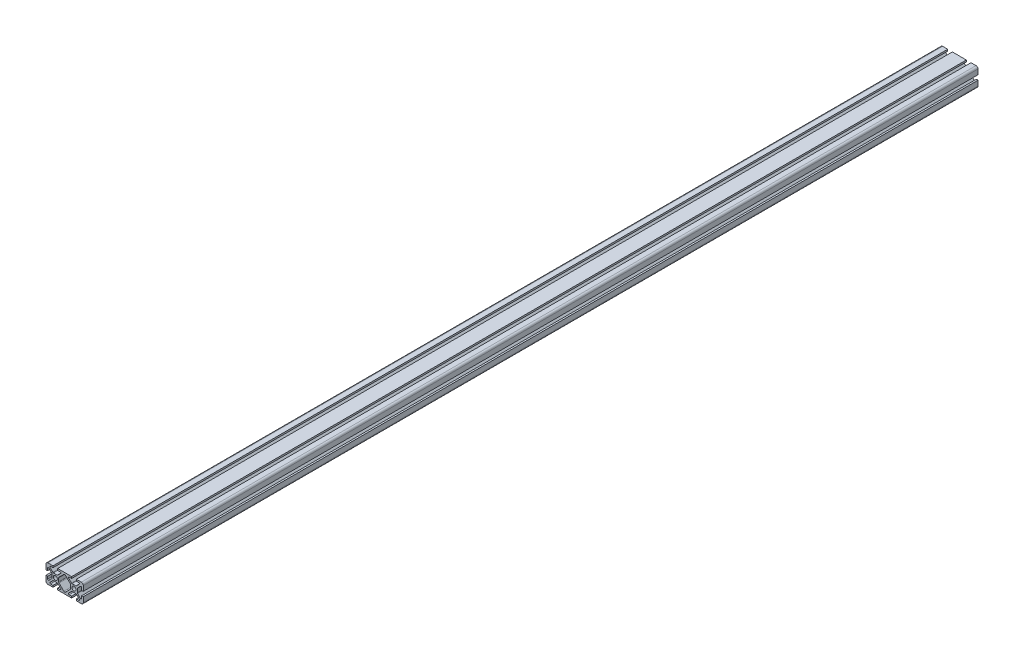
from build123d import *

# Parameters (mm, degrees)
BOSS_EXTRUDE1_DEPTH = 480
BOSS_EXTRUDE2_DEPTH = 480
FILLET1_R           = 0.75
FILLET2_R           = 1.25


with BuildPart() as part:
    # Sketch3 → Boss-Extrude1 (new, symmetric)
    with BuildSketch(Plane.XY):
        with BuildLine():
            Line((12.5, -10), (17.9, -10))
            ThreePointArc((17.9, -10), (19.38492424, -9.38492424), (20, -7.9))
            Line((20, -7.9), (20, -2.5))
            Line((20, -2.5), (18.213351365, -2.5))
            Line((18.213351365, -2.5), (18.213351365, -6.95))
            Line((18.213351365, -6.95), (13.6, -2.336648635))
            Line((13.6, -2.336648635), (13.6, 0))
            Line((13.6, 0), (12.15, 0))
            ThreePointArc((12.15, 0), (11.52027958, -1.52027958), (10, -2.15))
            Line((10, -2.15), (10, -3.6))
            Line((10, -3.6), (12.336648635, -3.6))
            Line((12.336648635, -3.6), (16.95, -8.213351365))
            Line((16.95, -8.213351365), (12.5, -8.213351365))
            Line((12.5, -8.213351365), (12.5, -10))
        make_face()
    extrude(amount=BOSS_EXTRUDE1_DEPTH, both=True)

    # Sketch4 → Boss-Extrude2 (add, symmetric)
    with BuildSketch(Plane.XY):
        with BuildLine():
            Line((10, -3.6), (7.663351365, -3.6))
            Line((7.663351365, -3.6), (3.05, -8.213351365))
            Line((3.05, -8.213351365), (7.5, -8.213351365))
            Line((7.5, -8.213351365), (7.5, -10))
            Line((7.5, -10), (0, -10))
            Line((0, -10), (0, -8.736648635))
            Line((0, -8.736648635), (6.4, -2.336648635))
            Line((6.4, -2.336648635), (6.4, 0))
            Line((6.4, 0), (7.85, 0))
            ThreePointArc((7.85, 0), (8.47972042, -1.52027958), (10, -2.15))
            Line((10, -2.15), (10, -3.6))
        make_face()
    extrude(amount=BOSS_EXTRUDE2_DEPTH, both=True)

    # Mirror1: part across plane


with BuildPart() as part_1:
    add(part.part)
    add(part.part.mirror(Plane(origin=(0, 0, 0), x_dir=(0, 0, 1), z_dir=(1, 0, 0))))

    # Mirror2: part across plane


with BuildPart() as part_2:
    add(part_1.part)
    add(part_1.part.mirror(Plane.ZX))

    # Fillet1
    fillet1_edges = [part_2.edges().sort_by_distance(p)[0] for p in [
        (-7.663351365, -3.6, 0),
        (-12.336648635, -3.6, 0),
        (12.336648635, -3.6, 0),
        (7.663351365, -3.6, 0),
        (-3.05, -8.213351365, 0),
        (-18.213351365, -6.95, 0),
        (-16.95, -8.213351365, 0),
        (-13.6, -2.336648635, 0),
        (-18.213351365, 6.95, 0),
        (-16.95, 8.213351365, 0),
        (-12.336648635, 3.6, 0),
        (-7.663351365, 3.6, 0),
        (-13.6, 2.336648635, 0),
        (-3.05, 8.213351365, 0),
        (3.05, 8.213351365, 0),
        (13.6, -2.336648635, 0),
        (13.6, 2.336648635, 0),
        (7.663351365, 3.6, 0),
        (12.336648635, 3.6, 0),
        (18.213351365, 6.95, 0),
        (16.95, 8.213351365, 0),
        (18.213351365, -6.95, 0),
        (16.95, -8.213351365, 0),
        (3.05, -8.213351365, 0),
    ]]
    fillet(fillet1_edges, radius=FILLET1_R)

    # Fillet2
    fillet2_edges = [part_2.edges().sort_by_distance(p)[0] for p in [
        (0, -8.736648635, 0),
        (-6.4, -2.336648635, 0),
        (-6.4, 2.336648635, 0),
        (6.4, -2.336648635, 0),
        (6.4, 2.336648635, 0),
        (0, 8.736648635, 0),
    ]]
    fillet(fillet2_edges, radius=FILLET2_R)


solid = part_2.part
